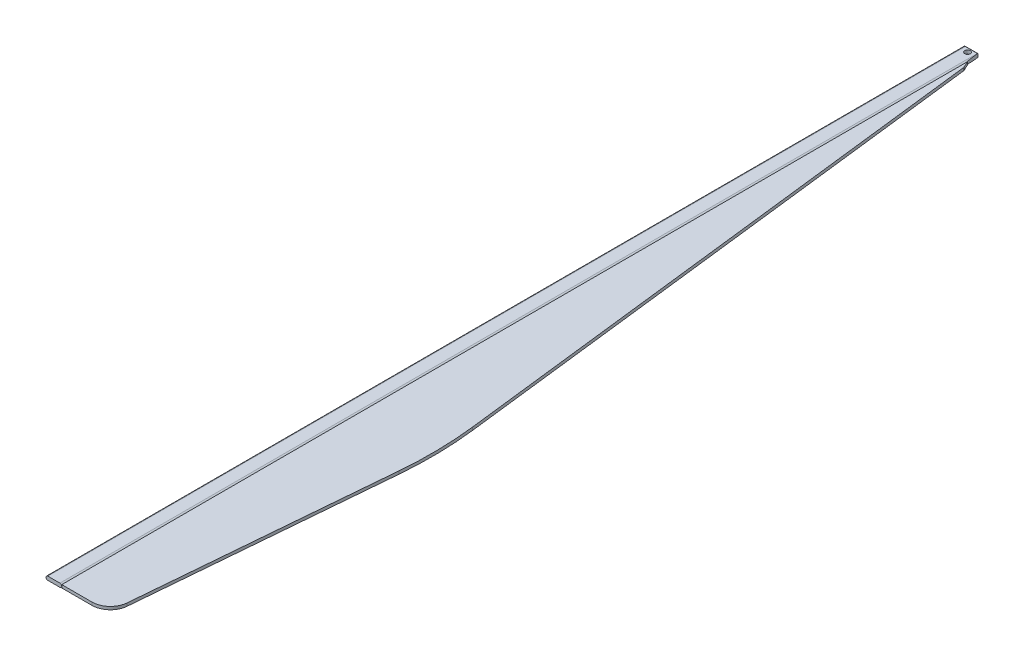
from build123d import *

# Parameters (mm, degrees)
SKETCH4_R                = 75
CUT_EXTRUDE1_DEPTH       = 25002.124474711
FILLET1_R                = 20
BOSS_EXTRUDE1_DEPTH      = 40
BOSS_EXTRUDE1_DEPTH_BACK = 40
CUT_EXTRUDE3_DEPTH       = 25094.387957556


with BuildPart() as part:
    # Sweep1: sweep along a path in Sketch2
    with BuildLine(Plane(origin=(0, 0, 0), x_dir=(1, 0, 0), z_dir=(0, 1, 0))) as sweep1_path:
        Line((0, 0), (0, -25000))
    # Sketch1 → Sweep1 (sweep)
    with BuildSketch(Plane.XY):
        with BuildLine():
            Line((-165, 50), (165, 50))
            ThreePointArc((165, 50), (215, 0), (165, -50))
            Line((165, -50), (-165, -50))
            ThreePointArc((-165, -50), (-215, 0), (-165, 50))
        make_face()
    sweep(path=sweep1_path.line)

    # Sketch4 → Cut-Extrude1 (cut, through all)
    with BuildSketch(Plane(origin=(0, 50, 0), x_dir=(1, 0, 0), z_dir=(0, 1, 0))):
        with Locations((0, -120)):
            Circle(SKETCH4_R)
    extrude(amount=-CUT_EXTRUDE1_DEPTH, mode=Mode.SUBTRACT)

    # Fillet1
    fillet1_edges = [part.edges().sort_by_distance(p)[0] for p in [
        (0, 50, 0),
        (215, 0, 0),
        (0, -50, 0),
        (-215, 0, 0),
    ]]
    fillet(fillet1_edges, radius=FILLET1_R)

    # Sketch6 → Cut-Extrude3 (cut, through all)
    with BuildSketch(Plane(origin=(0, 50, 0), x_dir=(1, 0, 0), z_dir=(0, 1, 0))):
        Polygon((215, -340.936948185), (215, 0), (165, 0), (202.453883363, -340.936948185), align=None)
    extrude(amount=-CUT_EXTRUDE3_DEPTH, mode=Mode.SUBTRACT)


with BuildPart() as body_2:
    # Sketch3 → Boss-Extrude1 (new, two sides: drawn at the far end of the back side and taken through both)
    with BuildSketch(Plane(origin=(0, 0, 0), x_dir=(1, 0, 0), z_dir=(0, 1, 0)).offset(-BOSS_EXTRUDE1_DEPTH_BACK)):
        with BuildLine():
            Line((215, -341.90407963), (297.337466598, -516.23531152))
            Line((297.337466598, -516.23531152), (2091.401198359, -15688.981349175))
            ThreePointArc((2091.401198359, -15688.981349175), (2159.332880841, -16705.105614449), (2123.565205696, -17722.869786237))
            Line((2123.565205696, -17722.869786237), (1535.100325172, -24542.982173614))
            ThreePointArc((1535.100325172, -24542.982173614), (1374.96668621, -24868.436620606), (1036.951218226, -25000))
            Line((1036.951218226, -25000), (215, -25000))
            Line((215, -25000), (215, -341.90407963))
        make_face()
    extrude(amount=BOSS_EXTRUDE1_DEPTH + BOSS_EXTRUDE1_DEPTH_BACK)


solid = Compound([part.part, body_2.part])
